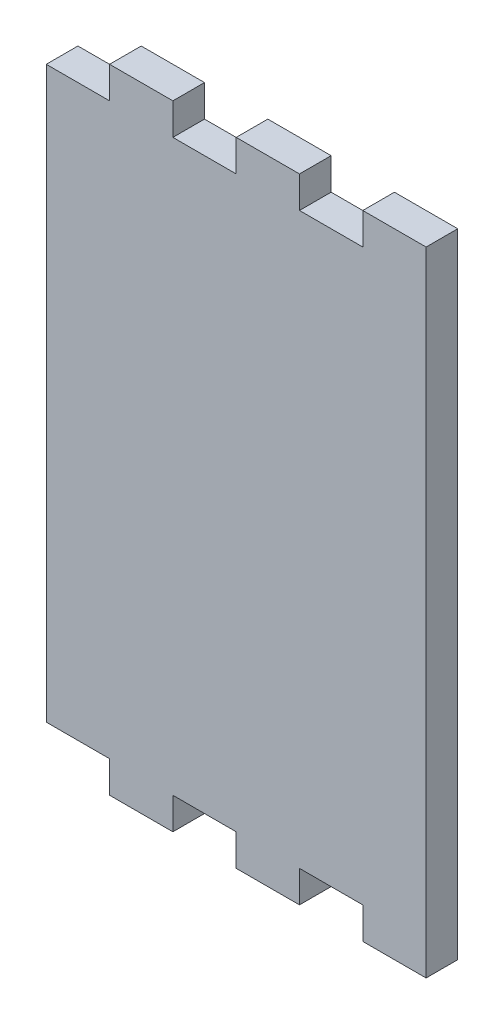
from build123d import *

# Parameters (mm, degrees)
SKETCH1_W           = 76.2
SKETCH1_H           = 127
BOSS_EXTRUDE1_DEPTH = 6.35
CAVITY1_START       = -44.45
CAVITY1_OUTLINE_W   = 6.35
CAVITY1_OUTLINE_H   = 6.35
CAVITY1_DEPTH       = 12.7
CAVITY1_START_2     = -19.05
CAVITY1_2_OUTLINE_W = 6.35
CAVITY1_2_OUTLINE_H = 6.35
CAVITY1_2_DEPTH     = 12.7
CAVITY1_START_3     = 6.35
CAVITY1_3_OUTLINE_W = 6.35
CAVITY1_3_OUTLINE_H = 6.35
CAVITY1_3_DEPTH     = 12.7


# Read off the part's stored shape, not the designer's step: Cavity1
with BuildPart() as part:
    # Sketch1 → Boss-Extrude1 (new body)
    with BuildSketch(Plane.XY):
        with Locations((-6.35, -63.5)):
            Rectangle(SKETCH1_W, SKETCH1_H)
    extrude(amount=-BOSS_EXTRUDE1_DEPTH)

    # Cavity1 outline → Cavity1 (cut)
    with BuildSketch(Plane.YZ.offset(CAVITY1_START)):
        with Locations((-123.825, -3.175)):
            Rectangle(CAVITY1_OUTLINE_W, CAVITY1_OUTLINE_H)
        with Locations((-3.175, -3.175)):
            Rectangle(CAVITY1_OUTLINE_W, CAVITY1_OUTLINE_H)
    extrude(amount=CAVITY1_DEPTH, mode=Mode.SUBTRACT)

    # Cavity1 2 outline → Cavity1 2 (cut)
    with BuildSketch(Plane.YZ.offset(CAVITY1_START_2)):
        with Locations((-123.825, -3.175)):
            Rectangle(CAVITY1_2_OUTLINE_W, CAVITY1_2_OUTLINE_H)
        with Locations((-3.175, -3.175)):
            Rectangle(CAVITY1_2_OUTLINE_W, CAVITY1_2_OUTLINE_H)
    extrude(amount=CAVITY1_2_DEPTH, mode=Mode.SUBTRACT)

    # Cavity1 3 outline → Cavity1 3 (cut)
    with BuildSketch(Plane.YZ.offset(CAVITY1_START_3)):
        with Locations((-123.825, -3.175)):
            Rectangle(CAVITY1_3_OUTLINE_W, CAVITY1_3_OUTLINE_H)
        with Locations((-3.175, -3.175)):
            Rectangle(CAVITY1_3_OUTLINE_W, CAVITY1_3_OUTLINE_H)
    extrude(amount=CAVITY1_3_DEPTH, mode=Mode.SUBTRACT)


solid = part.part
